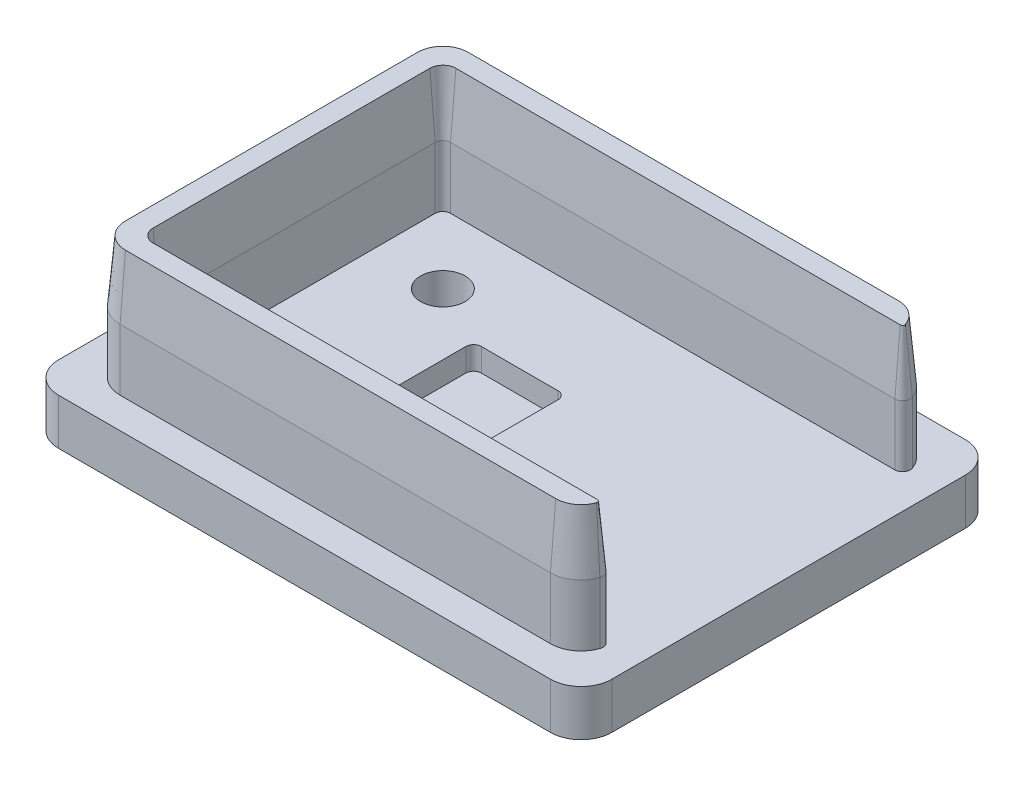
from build123d import *
from OCP.BRepFilletAPI import BRepFilletAPI_MakeChamfer

# Parameters (mm, degrees)
SKETCH1_W           = 36
SKETCH1_H           = 27
BOSS_EXTRUDE1_DEPTH = 3
SKETCH2_W           = 6
SKETCH2_H           = 6
CUT_EXTRUDE1_DEPTH  = 1.5
SKETCH3_R           = 1.45
CUT_EXTRUDE2_DEPTH  = 2.3
BOSS_EXTRUDE3_DEPTH = 8
FILLET1_R           = 2
FILLET2_R           = 0.5
FILLET3_R           = 0.5
CHAMFER2_SIZE       = 4
CHAMFER2_SIZE2      = 0.349954654


with BuildPart() as part:
    # Sketch1 → Boss-Extrude1 (new body)
    with BuildSketch(Plane(origin=(0, 0, 0), x_dir=(1, 0, 0), z_dir=(0, 1, 0))):
        Rectangle(SKETCH1_W, SKETCH1_H)
    extrude(amount=BOSS_EXTRUDE1_DEPTH)

    # Sketch2 → Cut-Extrude1 (cut)
    with BuildSketch(Plane(origin=(0, 3, 0), x_dir=(1, 0, 0), z_dir=(0, 1, 0))):
        with Locations((-2.5, 0)):
            Rectangle(SKETCH2_W, SKETCH2_H)
    extrude(amount=-CUT_EXTRUDE1_DEPTH, mode=Mode.SUBTRACT)

    # Sketch3 → Cut-Extrude2 (cut)
    with BuildSketch(Plane(origin=(0, 3, 0), x_dir=(1, 0, 0), z_dir=(0, 1, 0))):
        with Locations(Location((-9.5, 5, 0), (0, 0, 270))):
            Circle(SKETCH3_R)
        with Locations(Location((-9.5, -5, 0), (0, 0, 90))):
            Circle(SKETCH3_R)
    extrude(amount=-CUT_EXTRUDE2_DEPTH, mode=Mode.SUBTRACT)

    # Sketch4 → Boss-Extrude3 (add)
    with BuildSketch(Plane(origin=(0, 3, 0), x_dir=(1, 0, 0), z_dir=(0, 1, 0))):
        Polygon((-16, 11.5), (-16, -11.5), (16, -11.5), (16, -9.5), (-14, -9.5), (-14, 9.5), (16, 9.5), (16, 11.5), align=None)
    extrude(amount=BOSS_EXTRUDE3_DEPTH)

    # Fillet1
    fillet1_edges = [part.edges().sort_by_distance(p)[0] for p in [
        (-16, 7, -11.5),
        (16, 7, -11.5),
        (16, 7, 11.5),
        (-16, 7, 11.5),
        (-18, 1.5, 13.5),
        (18, 1.5, 13.5),
        (-18, 1.5, -13.5),
        (18, 1.5, -13.5),
    ]]
    fillet(fillet1_edges, radius=FILLET1_R - 0.0001)  # a hair under: the kernel refuses the full size

    # Fillet2
    fillet2_edges = [part.edges().sort_by_distance(p)[0] for p in [
        (-14, 7, 9.5),
        (-14, 7, -9.5),
    ]]
    fillet(fillet2_edges, radius=FILLET2_R)

    # Fillet3
    fillet3_edges = [part.edges().sort_by_distance(p)[0] for p in [
        (0.5, 2.25, -3),
        (0.5, 2.25, 3),
        (-5.5, 2.25, 3),
        (-5.5, 2.25, -3),
        (16, 7, 9.5),
        (16, 7, -9.5),
    ]]
    fillet(fillet3_edges, radius=FILLET3_R)

    # Chamfer2: one chamfer whose edges measure the first distance from different faces: ONE call of the kernel's chamfer builder (chamfer() names one face for all edges)
    chamfer2_edges_1 = [part.edges().sort_by_distance(p)[0] for p in [
        (0.957121425, 11, -9.5),
    ]]
    chamfer2_side_1 = [part.faces().sort_by_distance(p)[0] for p in [
        (0.957121425, 7, -9.5),
    ]]
    chamfer2_edges_2 = [part.edges().sort_by_distance(p)[0] for p in [
        (-14, 11, 0),
    ]]
    chamfer2_side_2 = [part.faces().sort_by_distance(p)[0] for p in [
        (-14, 7, 0),
    ]]
    chamfer2_edges_3 = [part.edges().sort_by_distance(p)[0] for p in [
        (-13.853553391, 11, -9.353553391),
    ]]
    chamfer2_side_3 = [part.faces().sort_by_distance(p)[0] for p in [
        (-13.853553391, 7, -9.353553391),
    ]]
    chamfer2_edges_4 = [part.edges().sort_by_distance(p)[0] for p in [
        (-13.853553391, 11, 9.353553391),
    ]]
    chamfer2_side_4 = [part.faces().sort_by_distance(p)[0] for p in [
        (-13.853553391, 7, 9.353553391),
    ]]
    chamfer2_edges_5 = [part.edges().sort_by_distance(p)[0] for p in [
        (15.154781293, 11, -11.132984295),
    ]]
    chamfer2_side_5 = [part.faces().sort_by_distance(p)[0] for p in [
        (15.154781293, 7, -11.132984295),
    ]]
    chamfer2_edges_6 = [part.edges().sort_by_distance(p)[0] for p in [
        (0.957121425, 11, 9.5),
    ]]
    chamfer2_side_6 = [part.faces().sort_by_distance(p)[0] for p in [
        (0.957121425, 7, 9.5),
    ]]
    chamfer2_edges_7 = [part.edges().sort_by_distance(p)[0] for p in [
        (15.822484336, 11, 9.711315242),
    ]]
    chamfer2_side_7 = [part.faces().sort_by_distance(p)[0] for p in [
        (15.822484336, 7, 9.711315242),
    ]]
    chamfer2_edges_8 = [part.edges().sort_by_distance(p)[0] for p in [
        (15.822484336, 11, -9.711315242),
    ]]
    chamfer2_side_8 = [part.faces().sort_by_distance(p)[0] for p in [
        (15.822484336, 7, -9.711315242),
    ]]
    chamfer2_edges_9 = [part.edges().sort_by_distance(p)[0] for p in [
        (-16, 11, 0),
    ]]
    chamfer2_side_9 = [part.faces().sort_by_distance(p)[0] for p in [
        (-16, 7, 0),
    ]]
    chamfer2_edges_10 = [part.edges().sort_by_distance(p)[0] for p in [
        (0, 11, -11.5),
    ]]
    chamfer2_side_10 = [part.faces().sort_by_distance(p)[0] for p in [
        (0, 7, -11.5),
    ]]
    chamfer2_edges_11 = [part.edges().sort_by_distance(p)[0] for p in [
        (0, 11, 11.5),
    ]]
    chamfer2_side_11 = [part.faces().sort_by_distance(p)[0] for p in [
        (0, 7, 11.5),
    ]]
    chamfer2_edges_12 = [part.edges().sort_by_distance(p)[0] for p in [
        (-15.414242852, 11, 10.914242852),
    ]]
    chamfer2_side_12 = [part.faces().sort_by_distance(p)[0] for p in [
        (-15.414242852, 7, 10.914242852),
    ]]
    chamfer2_edges_13 = [part.edges().sort_by_distance(p)[0] for p in [
        (15.154781293, 11, 11.132984295),
    ]]
    chamfer2_side_13 = [part.faces().sort_by_distance(p)[0] for p in [
        (15.154781293, 7, 11.132984295),
    ]]
    chamfer2_edges_14 = [part.edges().sort_by_distance(p)[0] for p in [
        (-15.414242852, 11, -10.914242852),
    ]]
    chamfer2_side_14 = [part.faces().sort_by_distance(p)[0] for p in [
        (-15.414242852, 7, -10.914242852),
    ]]
    chamfer2 = BRepFilletAPI_MakeChamfer(part.part.solid().wrapped)
    for e in chamfer2_edges_1:
        chamfer2.Add(CHAMFER2_SIZE, CHAMFER2_SIZE2, e.wrapped, chamfer2_side_1[0].wrapped)  # the first distance lies on this face
    for e in chamfer2_edges_2:
        chamfer2.Add(CHAMFER2_SIZE, CHAMFER2_SIZE2, e.wrapped, chamfer2_side_2[0].wrapped)  # the first distance lies on this face
    for e in chamfer2_edges_3:
        chamfer2.Add(CHAMFER2_SIZE, CHAMFER2_SIZE2, e.wrapped, chamfer2_side_3[0].wrapped)  # the first distance lies on this face
    for e in chamfer2_edges_4:
        chamfer2.Add(CHAMFER2_SIZE, CHAMFER2_SIZE2, e.wrapped, chamfer2_side_4[0].wrapped)  # the first distance lies on this face
    for e in chamfer2_edges_5:
        chamfer2.Add(CHAMFER2_SIZE, CHAMFER2_SIZE2, e.wrapped, chamfer2_side_5[0].wrapped)  # the first distance lies on this face
    for e in chamfer2_edges_6:
        chamfer2.Add(CHAMFER2_SIZE, CHAMFER2_SIZE2, e.wrapped, chamfer2_side_6[0].wrapped)  # the first distance lies on this face
    for e in chamfer2_edges_7:
        chamfer2.Add(CHAMFER2_SIZE, CHAMFER2_SIZE2, e.wrapped, chamfer2_side_7[0].wrapped)  # the first distance lies on this face
    for e in chamfer2_edges_8:
        chamfer2.Add(CHAMFER2_SIZE, CHAMFER2_SIZE2, e.wrapped, chamfer2_side_8[0].wrapped)  # the first distance lies on this face
    for e in chamfer2_edges_9:
        chamfer2.Add(CHAMFER2_SIZE, CHAMFER2_SIZE2, e.wrapped, chamfer2_side_9[0].wrapped)  # the first distance lies on this face
    for e in chamfer2_edges_10:
        chamfer2.Add(CHAMFER2_SIZE, CHAMFER2_SIZE2, e.wrapped, chamfer2_side_10[0].wrapped)  # the first distance lies on this face
    for e in chamfer2_edges_11:
        chamfer2.Add(CHAMFER2_SIZE, CHAMFER2_SIZE2, e.wrapped, chamfer2_side_11[0].wrapped)  # the first distance lies on this face
    for e in chamfer2_edges_12:
        chamfer2.Add(CHAMFER2_SIZE, CHAMFER2_SIZE2, e.wrapped, chamfer2_side_12[0].wrapped)  # the first distance lies on this face
    for e in chamfer2_edges_13:
        chamfer2.Add(CHAMFER2_SIZE, CHAMFER2_SIZE2, e.wrapped, chamfer2_side_13[0].wrapped)  # the first distance lies on this face
    for e in chamfer2_edges_14:
        chamfer2.Add(CHAMFER2_SIZE, CHAMFER2_SIZE2, e.wrapped, chamfer2_side_14[0].wrapped)  # the first distance lies on this face
    add(Compound.cast(chamfer2.Shape()), mode=Mode.REPLACE)


solid = part.part
